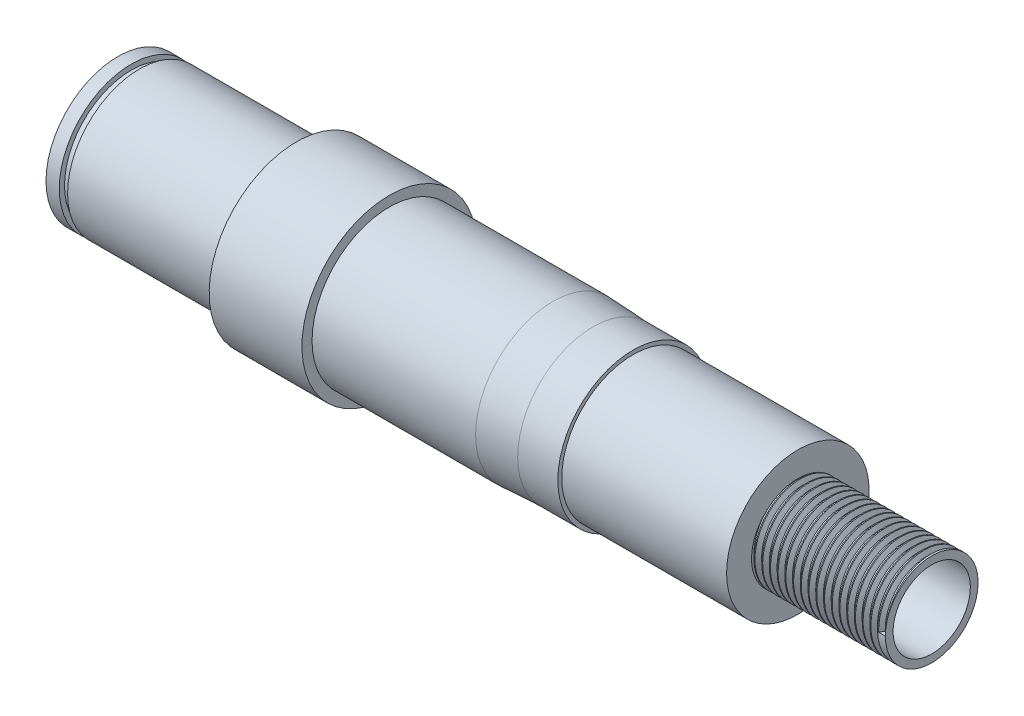
from build123d import *

# Parameters (mm, degrees)
THREAD1_PITCH      = 1.5
SKETCH5_R          = 7.5
CUT_EXTRUDE1_DEPTH = 105.319365985
CUT_EXTRUDE3_DEPTH = 3.5
SKETCH8_R          = 8
CUT_EXTRUDE4_DEPTH = 25.852


with BuildPart() as part:
    # Sketch1 → Revolve1 (revolve)
    with BuildSketch(Plane.XY, mode=Mode.PRIVATE) as revolve1_sk:
        Polygon((84.4169, 14.986), (92.20835, 14.605), (99.9998, 14.605), (99.9998, 13.843), (131.9998, 13.843), (131.9998, 9), (157.986265985, 9), (157.986265985, 0), (131.9998, 0), (99.9998, 0), (84.4169, 0), (52.6669, 0), (34.6583, 0), (0, 0), (0, 13.97), (2.5781, 13.97), (2.5781, 12.954), (4.191, 12.954), (4.191, 13.97), (34.6583, 13.97), (34.6583, 16.94815), (52.6669, 16.94815), (52.6669, 14.986), align=None)
    revolve(revolve1_sk.sketch.rotate(Axis((0, 0, 0), (1, 0, 0)), 90), axis=Axis((0, 0, 0), (1, 0, 0)))

    # Thread1: the profile of Thread Profile1 profile screwed along a right-hand helix of 17.324311 turns, 8 arcs to a turn; built about Z, then put on its axis
    thread1_z = Axis((0, 0, 0), (0, 0, 1))
    thread1_corners = [(9.0003, 0, -0.000173206), (9.0003, 0, 1.312673201), (8.188101187, 0, 0.843749997), (8.188101187, 0, 0.468749997)]
    with BuildLine(mode=Mode.PRIVATE) as thread1_profile:
        Line(thread1_corners[0], thread1_corners[1])
        Line(thread1_corners[1], thread1_corners[2])
        Line(thread1_corners[2], thread1_corners[3])
        Line(thread1_corners[3], thread1_corners[0])
    thread1_cap = Face(thread1_profile.wire())
    thread1_turn_angles = [0, 22.5, 45, 67.5, 90, 112.5, 135, 157.5, 180, 202.5, 225, 247.5, 270, 292.5, 315, 337.5, 360]
    thread1_turn_weights = [1, 0.9238795325112867, 1, 0.9238795325112867, 1, 0.9238795325112867, 1, 0.9238795325112867, 1, 0.9238795325112867, 1, 0.9238795325112867, 1, 0.9238795325112867, 1, 0.9238795325112867, 1]
    thread1_turn_rails = [Edge.make_bspline([Vector(p[0], p[1], 0).rotate(thread1_z, thread1_turn_angles[k]) / thread1_turn_weights[k] + Vector(0, 0, p[2] + THREAD1_PITCH * thread1_turn_angles[k] / 360) for k in range(17)], [0, 0, 0, 1, 1, 2, 2, 3, 3, 4, 4, 5, 5, 6, 6, 7, 7, 8, 8, 8], 2, thread1_turn_weights) for p in thread1_corners]
    thread1_turn_sides = [Face.make_surface_from_curves(thread1_turn_rails[p[0]], thread1_turn_rails[p[1]]) for p in [(0, 1), (1, 2), (2, 3), (3, 0)]]
    thread1_last_angles = [6120, 6142.5, 6165, 6187.5, 6210, 6223.375918258, 6236.751836516]
    thread1_last_weights = [1, 0.9238795325112867, 1, 0.9238795325112867, 1, 0.9728731972444735, 1]
    thread1_last_rails = [Edge.make_bspline([Vector(p[0], p[1], 0).rotate(thread1_z, thread1_last_angles[k]) / thread1_last_weights[k] + Vector(0, 0, p[2] + THREAD1_PITCH * thread1_last_angles[k] / 360) for k in range(7)], [0, 0, 0, 1, 1, 2, 2, 3, 3, 3], 2, thread1_last_weights) for p in thread1_corners]
    thread1_last_sides = [Face.make_surface_from_curves(thread1_last_rails[p[0]], thread1_last_rails[p[1]]) for p in [(0, 1), (1, 2), (2, 3), (3, 0)]]
    thread1 = Plane(origin=(157.986265985, 0, 0), x_dir=(0, 0, 1), z_dir=(-1, 0, 0)) * Solid(Shell([*[p.moved(Location((0, 0, THREAD1_PITCH * i))) for i in range(17) for p in thread1_turn_sides], *thread1_last_sides, thread1_cap, thread1_cap.rotate(thread1_z, 6236.751836516).moved(Location((0, 0, THREAD1_PITCH * 6236.751836516 / 360)))]))
    add(thread1, mode=Mode.SUBTRACT)

    # Sketch5 → Cut-Extrude1 (cut)
    with BuildSketch(Plane(origin=(157.986265985, 0, 0), x_dir=(0, 0, -1), z_dir=(1, 0, 0))):
        Circle(SKETCH5_R)
    extrude(amount=-CUT_EXTRUDE1_DEPTH, mode=Mode.SUBTRACT)

    # Sketch7 → Cut-Extrude3 (cut)
    with BuildSketch(Plane(origin=(0, -13.97, 0), x_dir=(-1, 0, 0), z_dir=(0, -1, 0))):
        with BuildLine():
            Line((-27.1183, 3), (-9.791, 3))
            ThreePointArc((-9.791, 3), (-6.791, 0), (-9.791, -3))
            Line((-9.791, -3), (-27.1183, -3))
            ThreePointArc((-27.1183, -3), (-30.1183, 0), (-27.1183, 3))
        make_face()
    extrude(amount=-CUT_EXTRUDE3_DEPTH, mode=Mode.SUBTRACT)

    # Sketch8 → Cut-Extrude4 (cut)
    with BuildSketch(Plane(origin=(0.871515357, 1.509508877, 0), x_dir=(0, 0, 1), z_dir=(-0.500000000000001, -0.866025403784438, 0))):
        with Locations(Location((0, -46.489043252, 0), (0, 0, 290.867315251))):
            Circle(SKETCH8_R)
    extrude(amount=-CUT_EXTRUDE4_DEPTH, mode=Mode.SUBTRACT)

    # Sketch9 → Cut-Revolve1 (revolve, cut)
    with BuildSketch(Plane(origin=(52.6669, 0, 0), x_dir=(0, 0, -1), z_dir=(1, 0, 0))):
        with BuildLine():
            Line((-7.5, 0), (7.5, 0))
            ThreePointArc((7.5, 0), (0, 7.5), (-7.5, 0))
        make_face()
    revolve(axis=Axis((52.6669, 0, 23.29747282), (0, 0, -1)), mode=Mode.SUBTRACT)


solid = part.part
